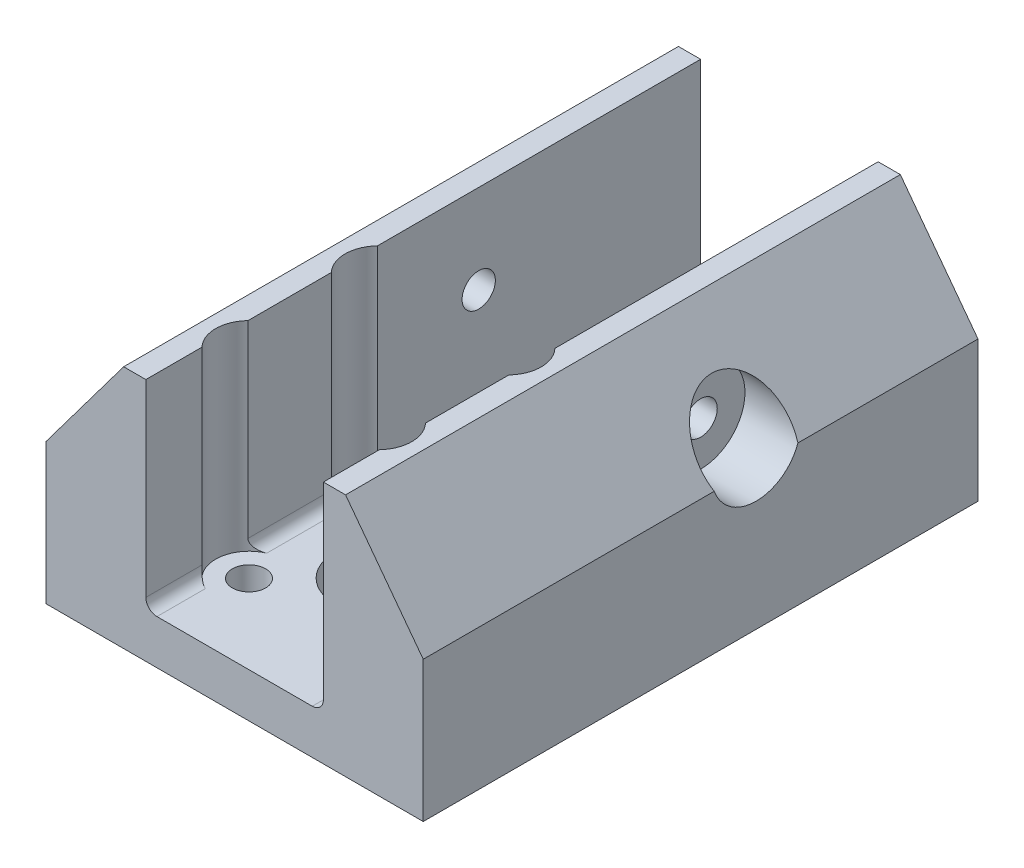
from build123d import *

# Parameters (mm, degrees)
SKETCH1_W               = 20
SKETCH1_H               = 20
SKETCH1_W_2             = 16
SKETCH1_H_2             = 16
BOSS_EXTRUDE1_DEPTH     = 50
SKETCH2_W               = 16
SKETCH2_H               = 50
CUT_EXTRUDE1_DEPTH      = 13
SKETCH4_W               = 50
SKETCH4_H               = 50
BOSS_EXTRUDE2_DEPTH     = 2
BOSS_EXTRUDE3_DEPTH     = 50
SKETCH6_R               = 4
CUT_EXTRUDE2_DEPTH      = 4
SKETCH7_R               = 1.5
CUT_EXTRUDE3_DEPTH      = 64.820059542
SKETCH8_R               = 2
CUT_EXTRUDE4_DEPTH      = 63.553976692
FILLET1_R               = 1
CUT_EXTRUDE5_DEPTH      = 63.553976801
CUT_EXTRUDE5_DEPTH_BACK = 63.553976801
SKETCH11_R              = 1.5
SKETCH12_W              = 8
SKETCH12_H              = 12.666666667
CUT_EXTRUDE6_DEPTH      = 63.553976801
SKETCH13_R              = 3
CUT_EXTRUDE7_DEPTH      = 59.728187556
SKETCH15_R              = 4
CUT_EXTRUDE8_DEPTH      = 5
CUT_EXTRUDE9_START      = -5
SKETCH16_R              = 4
CUT_EXTRUDE9_DEPTH      = 5
SKETCH17_R              = 3.993868221
CUT_EXTRUDE10_DEPTH     = 2


with BuildPart() as part:
    # Sketch1 → Boss-Extrude1 (new body)
    with BuildSketch(Plane.XY):
        with Locations((8, 8)):
            Rectangle(SKETCH1_W, SKETCH1_H)
        with Locations((8, 8)):
            Rectangle(SKETCH1_W_2, SKETCH1_H_2, mode=Mode.SUBTRACT)
    extrude(amount=BOSS_EXTRUDE1_DEPTH)

    # Sketch2 → Cut-Extrude1 (cut)
    with BuildSketch(Plane(origin=(0, 18, 0), x_dir=(1, 0, 0), z_dir=(0, 1, 0))):
        with Locations((8, -25)):
            Rectangle(SKETCH2_W, SKETCH2_H)
    extrude(amount=-CUT_EXTRUDE1_DEPTH, mode=Mode.SUBTRACT)

    # Sketch4 → Boss-Extrude2 (add)
    with BuildSketch(Plane.XZ.offset(2)):
        with Locations((8, 25)):
            Rectangle(SKETCH4_W, SKETCH4_H)
    extrude(amount=BOSS_EXTRUDE2_DEPTH)

    # Sketch5 → Boss-Extrude3 (add)
    with BuildSketch(Plane(origin=(0, 0, 0), x_dir=(-1, 0, 0), z_dir=(0, 0, -1))):
        Polygon((-18, 18), (-33, -2), (-18, -2), align=None)
        Polygon((2, 18), (17, -2), (2, -2), align=None)
    extrude(amount=-BOSS_EXTRUDE3_DEPTH)

    # Sketch6 → Cut-Extrude2 (cut)
    with BuildSketch(Plane.XZ.offset(4)):
        with Locations((8, 37)):
            Circle(SKETCH6_R)
    extrude(amount=-CUT_EXTRUDE2_DEPTH, mode=Mode.SUBTRACT)

    # Sketch7 → Cut-Extrude3 (cut, through all)
    with BuildSketch(Plane.XZ.offset(4)):
        with Locations((13.833630945, 42.872103543)):
            Circle(SKETCH7_R)
        with Locations((13.833630945, 31.204841653)):
            Circle(SKETCH7_R)
        with Locations((2.166369055, 31.204841653)):
            Circle(SKETCH7_R)
        with Locations((2.166369055, 42.872103543)):
            Circle(SKETCH7_R)
    extrude(amount=-CUT_EXTRUDE3_DEPTH, mode=Mode.SUBTRACT)

    # Sketch8 → Cut-Extrude4 (cut, through all)
    with BuildSketch(Plane(origin=(0, 0, 0), x_dir=(1, 0, 0), z_dir=(0, 1, 0))):
        with Locations((8, -12)):
            Circle(SKETCH8_R)
    extrude(amount=-CUT_EXTRUDE4_DEPTH, mode=Mode.SUBTRACT)

    # Fillet1
    fillet1_edges = [part.edges().sort_by_distance(p)[0] for p in [
        (16, 0, 25),
    ]]
    fillet(fillet1_edges, radius=FILLET1_R)
    fillet1_2_edges = [part.edges().sort_by_distance(p)[0] for p in [
        (0, 0, 25),
    ]]
    fillet(fillet1_2_edges, radius=FILLET1_R)

    # Sketch11 → Cut-Extrude5 (cut, two sides: drawn at the far end of the back side and taken through both)
    with BuildSketch(Plane(origin=(0, 0, 0), x_dir=(0, 0, -1), z_dir=(1, 0, 0)).offset(-CUT_EXTRUDE5_DEPTH_BACK)):
        with Locations((-20, 10)):
            Circle(SKETCH11_R)
    extrude(amount=CUT_EXTRUDE5_DEPTH + CUT_EXTRUDE5_DEPTH_BACK, mode=Mode.SUBTRACT)

    # Sketch12 → Cut-Extrude6 (cut, through all)
    with BuildSketch(Plane.XY.offset(50)):
        with Locations((-13, 2.333333334)):
            Rectangle(SKETCH12_W, SKETCH12_H)
        with Locations((29, 2.333333334)):
            Rectangle(SKETCH12_W, SKETCH12_H)
    extrude(amount=-CUT_EXTRUDE6_DEPTH, mode=Mode.SUBTRACT)

    # Sketch13 → Cut-Extrude7 (cut, through all)
    with BuildSketch(Plane(origin=(0, 0, 0), x_dir=(1, 0, 0), z_dir=(0, 1, 0))):
        with Locations((2.166369055, -31.204841653)):
            Circle(SKETCH13_R)
        with Locations((13.833630945, -31.204841653)):
            Circle(SKETCH13_R)
        with Locations((13.833630945, -42.872103543)):
            Circle(SKETCH13_R)
        with Locations((2.166369055, -42.872103543)):
            Circle(SKETCH13_R)
    extrude(amount=CUT_EXTRUDE7_DEPTH, mode=Mode.SUBTRACT)

    # Sketch15 → Cut-Extrude8 (cut)
    with BuildSketch(Plane(origin=(25, 0, 0), x_dir=(0, 0, -1), z_dir=(1, 0, 0))):
        with Locations((-20, 10)):
            Circle(SKETCH15_R)
    extrude(amount=-CUT_EXTRUDE8_DEPTH, mode=Mode.SUBTRACT)

    # Sketch16 → Cut-Extrude9 (cut)
    with BuildSketch(Plane.ZY.offset(9).offset(CUT_EXTRUDE9_START)):
        with Locations((20, 10)):
            Circle(SKETCH16_R)
    extrude(amount=CUT_EXTRUDE9_DEPTH, mode=Mode.SUBTRACT)

    # Sketch17 → Cut-Extrude10 (cut)
    with BuildSketch(Plane.XZ.offset(4)):
        with Locations((8, 12)):
            Circle(SKETCH17_R)
    extrude(amount=-CUT_EXTRUDE10_DEPTH, mode=Mode.SUBTRACT)


solid = part.part
